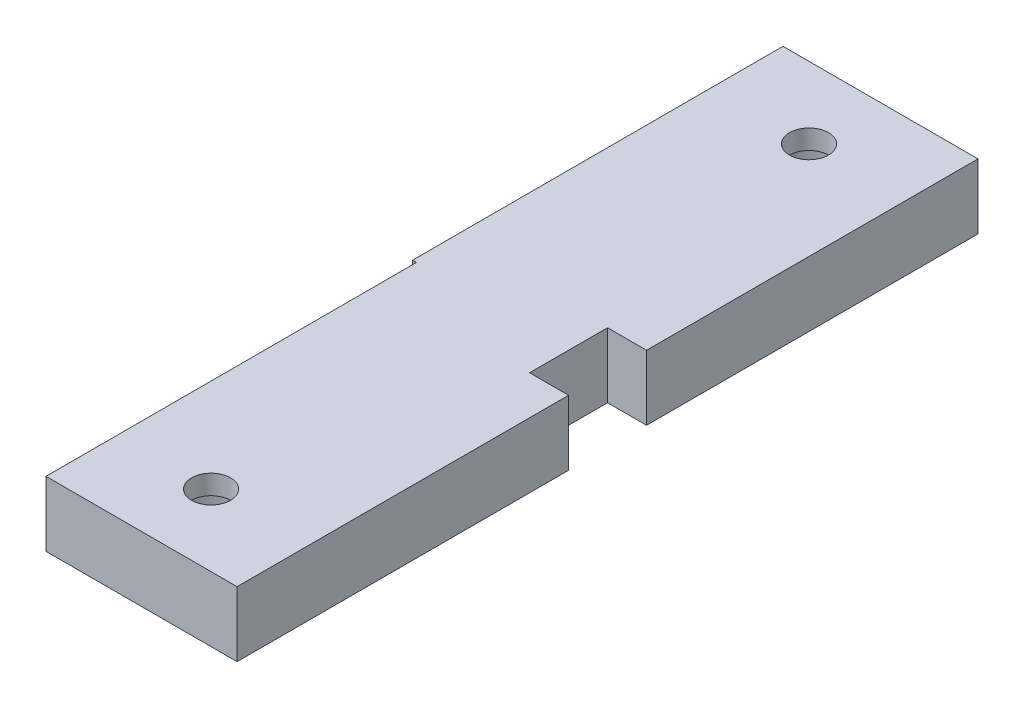
from build123d import *

# Parameters (mm, degrees)
SKETCH_2_W          = 21
SKETCH_2_H          = 57
EXTRUDE_1_DEPTH     = 5
SKETCH_3_R          = 1.5
CUT_EXTRUDE_1_DEPTH = 5
SKETCH_4_R          = 1.5
CUT_EXTRUDE_2_DEPTH = 5
SKETCH_5_R          = 3.5
CUT_EXTRUDE_3_DEPTH = 3.5
SKETCH_6_R          = 3.5
CUT_EXTRUDE_4_DEPTH = 3.5
SKETCH_8_W          = 3
SKETCH_8_H          = 57
CUT_EXTRUDE_5_DEPTH = 5
CUT_EXTRUDE_7_DEPTH = 5
SKETCH_11_W         = 0.3
SKETCH_11_H         = 28.5
CUT_EXTRUDE_8_DEPTH = 5


with BuildPart() as part:
    # 草图2 → 凸台-拉伸1 (new body)
    with BuildSketch(Plane(origin=(0, 0, 0), x_dir=(1, 0, 0), z_dir=(0, 1, 0))):
        with Locations((-11.930654931, -13.970581751)):
            Rectangle(SKETCH_2_W, SKETCH_2_H)
    extrude(amount=EXTRUDE_1_DEPTH)

    # 草图3 → 切除-拉伸1 (cut)
    with BuildSketch(Plane(origin=(0, 5, 0), x_dir=(1, 0, 0), z_dir=(0, 1, 0))):
        with Locations((-11.930654931, -36.970581751)):
            Circle(SKETCH_3_R)
    extrude(amount=-CUT_EXTRUDE_1_DEPTH, mode=Mode.SUBTRACT)

    # 草图4 → 切除-拉伸2 (cut)
    with BuildSketch(Plane(origin=(0, 5, 0), x_dir=(1, 0, 0), z_dir=(0, 1, 0))):
        with Locations((-11.930654931, 9.029418249)):
            Circle(SKETCH_4_R)
    extrude(amount=-CUT_EXTRUDE_2_DEPTH, mode=Mode.SUBTRACT)

    # 草图5 → 切除-拉伸3 (cut)
    with BuildSketch(Plane.XZ):
        with Locations((-11.930654931, -9.029418249)):
            Circle(SKETCH_5_R)
    extrude(amount=-CUT_EXTRUDE_3_DEPTH, mode=Mode.SUBTRACT)

    # 草图6 → 切除-拉伸4 (cut)
    with BuildSketch(Plane.XZ):
        with Locations((-11.930654931, 36.970581751)):
            Circle(SKETCH_6_R)
    extrude(amount=-CUT_EXTRUDE_4_DEPTH, mode=Mode.SUBTRACT)

    # 草图8 → 切除-拉伸5 (cut)
    with BuildSketch(Plane(origin=(0, 5, 0), x_dir=(1, 0, 0), z_dir=(0, 1, 0))):
        with Locations((-20.930654931, -13.970581751)):
            Rectangle(SKETCH_8_W, SKETCH_8_H)
        with Locations((-2.930654931, -13.970581751)):
            Rectangle(SKETCH_8_W, SKETCH_8_H)
    extrude(amount=-CUT_EXTRUDE_5_DEPTH, mode=Mode.SUBTRACT)

    # 草图10 → 切除-拉伸7 (cut)
    with BuildSketch(Plane(origin=(0, 5, 0), x_dir=(1, 0, 0), z_dir=(0, 1, 0))):
        Polygon((-4.430654931, -13.970581751), (-4.430654931, -10.970581751), (-7.430654931, -10.970581751), (-7.430654931, -16.970581751), (-4.430654931, -16.970581751), align=None)
    extrude(amount=-CUT_EXTRUDE_7_DEPTH, mode=Mode.SUBTRACT)

    # 草图11 → 切除-拉伸8 (cut)
    with BuildSketch(Plane.XZ):
        with Locations((-19.280654931, 28.220581751)):
            Rectangle(SKETCH_11_W, SKETCH_11_H)
    extrude(amount=-CUT_EXTRUDE_8_DEPTH, mode=Mode.SUBTRACT)


solid = part.part
